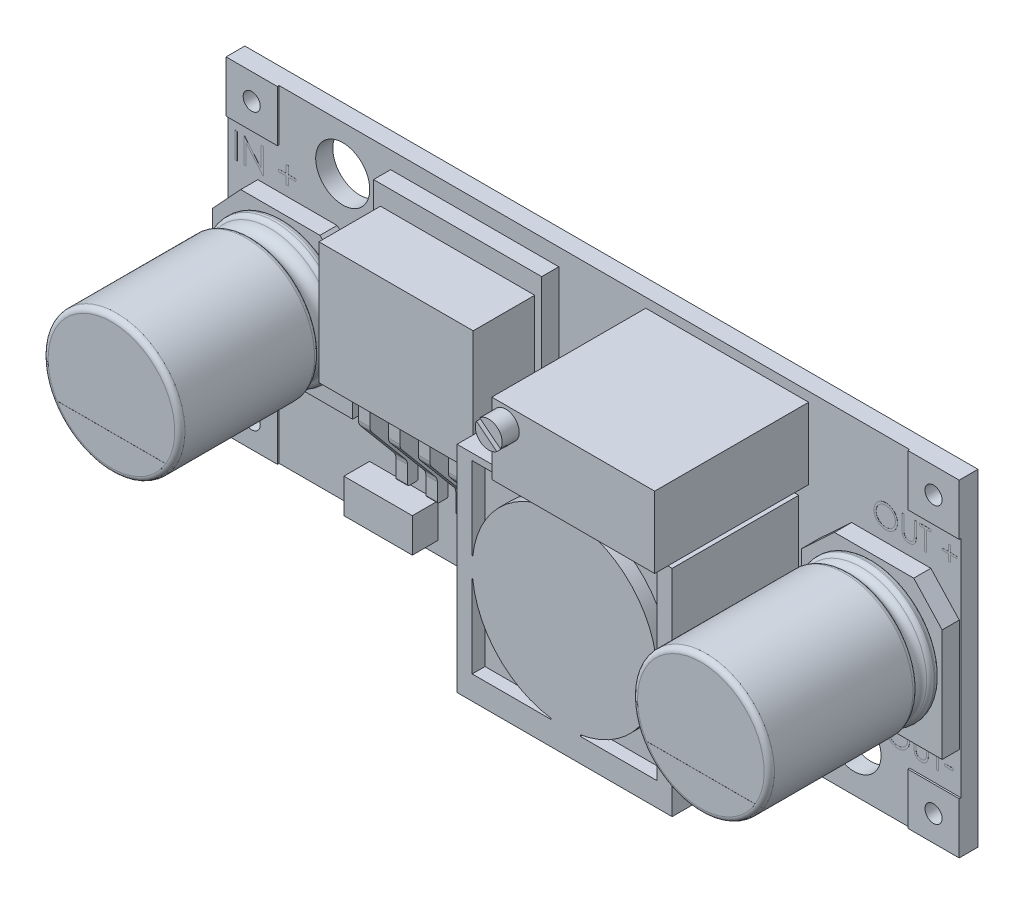
from build123d import *

# Parameters (mm, degrees)
SKETCH1_W            = 42.852737666
SKETCH1_H            = 19.127379028
SKETCH1_R            = 1.58
BOSS_EXTRUDE1_DEPTH  = 1
SKETCH2_W            = 3
SKETCH2_H            = 3
BOSS_EXTRUDE2_DEPTH  = 0.1
SKETCH3_R            = 0.5
CUT_EXTRUDE1_DEPTH   = 5
BOSS_EXTRUDE3_DEPTH  = 1
SKETCH6_W            = 9.83
SKETCH6_H            = 8.75
BOSS_EXTRUDE5_DEPTH  = 4.6
SKETCH7_W            = 9.83
SKETCH7_H            = 8.75
SKETCH7_W_2          = 9.014866003
SKETCH7_H_2          = 7.13033049
CUT_EXTRUDE2_DEPTH   = 3.6
SKETCH8_W            = 0.671327252
SKETCH8_H            = 3.75
BOSS_EXTRUDE6_DEPTH  = 8
SKETCH10_W           = 12.57
SKETCH10_H           = 12.57
BOSS_EXTRUDE7_DEPTH  = 7.4
CUT_EXTRUDE7_DEPTH   = 0.75
SKETCH13_W           = 9.52
SKETCH13_H           = 4.17
BOSS_EXTRUDE8_DEPTH  = 9
SKETCH14_R           = 0.785768403
BOSS_EXTRUDE9_DEPTH  = 1
CUT_EXTRUDE8_DEPTH   = 0.4
CUT_EXTRUDE10_DEPTH  = 9
SKETCH21_W           = 1
SKETCH21_H           = 0.471986251
BOSS_EXTRUDE11_DEPTH = 8.8665
BOSS_EXTRUDE15_DEPTH = 0.005
BOSS_EXTRUDE16_DEPTH = 0.005
SKETCH26_W           = 4
SKETCH26_H           = 2
BOSS_EXTRUDE18_DEPTH = 1.5
SKETCH28_W           = 0.134615385
SKETCH28_H           = 1.5
SKETCH28_W_2         = 0.576923077
SKETCH28_H_2         = 0.153846154
BOSS_EXTRUDE19_DEPTH = 0.005
SKETCH29_W           = 0.134615385
SKETCH29_H           = 1.5
BOSS_EXTRUDE20_DEPTH = 0.005
BOSS_EXTRUDE21_DEPTH = 0.005
SKETCH32_W           = 0.5
SKETCH32_H           = 0.133333333
BOSS_EXTRUDE23_DEPTH = 0.005


with BuildPart() as part:
    # Sketch1 → Boss-Extrude1 (new body)
    with BuildSketch(Plane.XY):
        Rectangle(SKETCH1_W, SKETCH1_H)
        with Locations((-14.706368833, 6.953689514)):
            Circle(SKETCH1_R, mode=Mode.SUBTRACT)
        with Locations((15.176368833, -6.773993326)):
            Circle(SKETCH1_R, mode=Mode.SUBTRACT)
    extrude(amount=BOSS_EXTRUDE1_DEPTH)

    # Sketch2 → Boss-Extrude2 (add)
    with BuildSketch(Plane.XY.offset(1)):
        with Locations((-19.926368833, 8.063689514)):
            Rectangle(SKETCH2_W, SKETCH2_H)
        with Locations((-19.926368833, -8.063689514)):
            Rectangle(SKETCH2_W, SKETCH2_H)
        with Locations((19.926368833, -8.063689514)):
            Rectangle(SKETCH2_W, SKETCH2_H)
        with Locations((19.926368833, 8.063689514)):
            Rectangle(SKETCH2_W, SKETCH2_H)
    extrude(amount=BOSS_EXTRUDE2_DEPTH)

    # Sketch3 → Cut-Extrude1 (cut)
    with BuildSketch(Plane.XY.offset(1.1)):
        with Locations((-19.926368833, 8.063689514)):
            Circle(SKETCH3_R)
        with Locations((-19.926368833, -8.063689514)):
            Circle(SKETCH3_R)
        with Locations((19.926368833, -8.063689514)):
            Circle(SKETCH3_R)
        with Locations((19.926368833, 8.063689514)):
            Circle(SKETCH3_R)
    extrude(amount=-CUT_EXTRUDE1_DEPTH, mode=Mode.SUBTRACT)

    # Sketch4 → Boss-Extrude3 (add)
    with BuildSketch(Plane.XY.offset(1)):
        Polygon((-19.66991348, 4.175), (-21.331368833, 2.383236744), (-21.331368833, -4.175), (-13.121368833, -4.175), (-13.121368833, 2.397984661), (-15.037755442, 4.175), align=None)
        Polygon((19.66991348, 4.175), (15.037755442, 4.175), (13.121368833, 2.397984661), (13.121368833, -4.175), (21.331368833, -4.175), (21.331368833, 2.383236744), align=None)
    extrude(amount=BOSS_EXTRUDE3_DEPTH)

    # Sketch6 → Boss-Extrude5 (add)
    with BuildSketch(Plane.XY.offset(1)):
        with Locations((-6.991368833, 4.188689514)):
            Rectangle(SKETCH6_W, SKETCH6_H)
    extrude(amount=BOSS_EXTRUDE5_DEPTH)

    # Sketch7 → Cut-Extrude2 (cut)
    with BuildSketch(Plane.XY.offset(5.6)):
        with Locations((-6.991368833, 4.188689514)):
            Rectangle(SKETCH7_W, SKETCH7_H)
        with Locations((-6.991368834, 3.853025888)):
            Rectangle(SKETCH7_W_2, SKETCH7_H_2, mode=Mode.SUBTRACT)
    extrude(amount=-CUT_EXTRUDE2_DEPTH, mode=Mode.SUBTRACT)

    # Sketch8 → Boss-Extrude6 (add)
    with BuildSketch(Plane(origin=(0, 0.287860643, 0), x_dir=(-1, 0, 0), z_dir=(0, -1, 0))):
        with Locations((8.85699558, -2.895840935)):
            Rectangle(SKETCH8_W, SKETCH8_H)
        with Locations((10.60699558, -2.895840935)):
            Rectangle(SKETCH8_W, SKETCH8_H)
        with Locations((7.10699558, -2.895840935)):
            Rectangle(SKETCH8_W, SKETCH8_H)
        with Locations((5.35699558, -2.895840935)):
            Rectangle(SKETCH8_W, SKETCH8_H)
        with Locations((3.60699558, -2.895840935)):
            Rectangle(SKETCH8_W, SKETCH8_H)
    extrude(amount=BOSS_EXTRUDE6_DEPTH)

    # Sketch10 → Boss-Extrude7 (add)
    with BuildSketch(Plane.XY.offset(1)):
        with Locations((5.661368833, -2.278689514)):
            Rectangle(SKETCH10_W, SKETCH10_H)
    extrude(amount=BOSS_EXTRUDE7_DEPTH)

    # Sketch11 → Cut-Extrude7 (cut)
    with BuildSketch(Plane.XY.offset(8.4)):
        with BuildLine():
            Line((0.261368833, -1.168201078), (0.29215187, -1.202921155))
            ThreePointArc((0.29215187, -1.202921155), (1.796004083, 1.992113497), (4.952819072, 3.574623221))
            Line((4.952819072, 3.574623221), (4.952819072, 3.621310486))
            Line((4.952819072, 3.621310486), (0.261368833, 3.621310486))
            Line((0.261368833, 3.621310486), (0.261368833, -1.168201078))
        make_face()
        with BuildLine():
            Line((0.261368833, -2.339421454), (0.29215187, -2.354457873))
            ThreePointArc((0.29215187, -2.354457873), (1.77039453, -5.523061153), (4.879917239, -7.121847139))
            Line((4.879917239, -7.121847139), (4.879917239, -7.178689514))
            Line((4.879917239, -7.178689514), (0.261368833, -7.178689514))
            Line((0.261368833, -7.178689514), (0.261368833, -2.339421454))
        make_face()
        with BuildLine():
            Line((11.061368833, -7.178689514), (11.061368833, -2.769135856))
            Line((11.061368833, -2.769135856), (10.969759931, -2.769135856))
            ThreePointArc((10.969759931, -2.769135856), (9.454565933, -5.622080694), (6.581950193, -7.099641493))
            Line((6.581950193, -7.099641493), (6.581950193, -7.178689514))
            Line((6.581950193, -7.178689514), (11.061368833, -7.178689514))
        make_face()
        with BuildLine():
            Line((6.280607425, 3.621310486), (6.280607425, 3.585687763))
            ThreePointArc((6.280607425, 3.585687763), (9.344711933, 2.170105696), (10.969759931, -0.788243173))
            Line((10.969759931, -0.788243173), (11.061368833, -0.788243173))
            Line((11.061368833, -0.788243173), (11.061368833, 3.621310486))
            Line((11.061368833, 3.621310486), (6.280607425, 3.621310486))
        make_face()
    extrude(amount=-CUT_EXTRUDE7_DEPTH, mode=Mode.SUBTRACT)

    # Sketch13 → Boss-Extrude8 (add)
    with BuildSketch(Plane.XY.offset(1)):
        with Locations((7.766965878, 6.922076652)):
            Rectangle(SKETCH13_W, SKETCH13_H)
    extrude(amount=BOSS_EXTRUDE8_DEPTH)

    # Sketch14 → Boss-Extrude9 (add)
    with BuildSketch(Plane.XY.offset(10)):
        with Locations((3.826540336, 8.02238566)):
            Circle(SKETCH14_R)
    extrude(amount=BOSS_EXTRUDE9_DEPTH)

    # Sketch16 → Cut-Extrude8 (cut)
    with BuildSketch(Plane.XY.offset(11)):
        Polygon((3.174779735, 8.708212326), (4.655828555, 7.530657116), (4.452314558, 7.274691057), (2.971265737, 8.452246267), align=None)
    extrude(amount=-CUT_EXTRUDE8_DEPTH, mode=Mode.SUBTRACT)

    # Sketch17 → Revolve1 (revolve)
    with BuildSketch(Plane(origin=(0, 0, 0), x_dir=(1, 0, 0), z_dir=(0, 1, 0))):
        with BuildLine():
            Line((-17.226368833, -2), (-17.226368833, -12))
            Line((-17.226368833, -12), (-20.926368833, -12))
            ThreePointArc((-20.926368833, -12), (-21.138500868, -11.912132034), (-21.226368833, -11.7))
            Line((-21.226368833, -11.7), (-21.226368833, -4.126856579))
            ThreePointArc((-21.226368833, -4.126856579), (-21.171634617, -3.954100406), (-21.027404197, -3.844382058))
            ThreePointArc((-21.027404197, -3.844382058), (-20.635591614, -3.288117016), (-21.027404197, -2.731851974))
            ThreePointArc((-21.027404197, -2.731851974), (-21.171634617, -2.622133626), (-21.226368833, -2.449377452))
            Line((-21.226368833, -2.449377452), (-21.226368833, -2.3))
            ThreePointArc((-21.226368833, -2.3), (-21.138500868, -2.087867966), (-20.926368833, -2))
            Line((-20.926368833, -2), (-17.226368833, -2))
        make_face()
    revolve(axis=Axis((-17.226368833, 0, 2), (0, 0, 1)))

    # Sketch18 → Revolve2 (revolve)
    with BuildSketch(Plane(origin=(0, 0, 0), x_dir=(1, 0, 0), z_dir=(0, 1, 0))):
        with BuildLine():
            Line((17.226368833, -2), (17.226368833, -12))
            Line((17.226368833, -12), (20.926368833, -12))
            ThreePointArc((20.926368833, -12), (21.138500868, -11.912132034), (21.226368833, -11.7))
            Line((21.226368833, -11.7), (21.226368833, -3.602613577))
            ThreePointArc((21.226368833, -3.602613577), (21.180569431, -3.443296107), (21.057155126, -3.332622937))
            ThreePointArc((21.057155126, -3.332622937), (20.838223322, -2.983304086), (21.057155126, -2.633985236))
            ThreePointArc((21.057155126, -2.633985236), (21.180569431, -2.523312065), (21.226368833, -2.363994596))
            Line((21.226368833, -2.363994596), (21.226368833, -2.3))
            ThreePointArc((21.226368833, -2.3), (21.138500868, -2.087867966), (20.926368833, -2))
            Line((20.926368833, -2), (17.226368833, -2))
        make_face()
    revolve(axis=Axis((17.226368833, 0, 2), (0, 0, 1)))

    # Sketch20 → Cut-Extrude10 (cut)
    with BuildSketch(Plane.ZY.offset(10.942659206)):
        with BuildLine():
            Line((3.844382058, 0.289594832), (3.844382058, -2.233611219))
            ThreePointArc((3.844382058, -2.233611219), (3.814255779, -2.404545961), (3.727507314, -2.554882192))
            Line((3.727507314, -2.554882192), (1.771316926, -4.887697811))
            ThreePointArc((1.771316926, -4.887697811), (1.684568461, -5.038034042), (1.654442182, -5.208968784))
            Line((1.654442182, -5.208968784), (1.654442182, -6.229630862))
            ThreePointArc((1.654442182, -6.229630862), (1.62515286, -6.30034154), (1.554442182, -6.329630862))
            Line((1.554442182, -6.329630862), (1.11972155, -6.329630862))
            ThreePointArc((1.11972155, -6.329630862), (1.049409976, -6.300738404), (1.019727886, -6.230756512))
            Line((1.019727886, -6.230756512), (1.020840935, -4.455804963))
            Line((1.020840935, -4.455804963), (1.118926503, -4.336466333))
            Line((1.118926503, -4.336466333), (2.914592321, -2.19508107))
            ThreePointArc((2.914592321, -2.19508107), (3.001340787, -2.044744838), (3.031467065, -1.873810097))
            Line((3.031467065, -1.873810097), (3.031467065, 0.289594832))
            Line((3.031467065, 0.289594832), (1, 0.289594832))
            Line((1, 0.289594832), (1.020840935, -10.491278281))
            Line((1.020840935, -10.491278281), (8.137669671, -10.491278281))
            Line((8.137669671, -10.491278281), (8.137669671, 0.289594832))
            Line((8.137669671, 0.289594832), (3.844382058, 0.289594832))
        make_face()
    extrude(amount=-CUT_EXTRUDE10_DEPTH, mode=Mode.SUBTRACT)

    # Sketch21 → Boss-Extrude11 (add)
    with BuildSketch(Plane(origin=(-10.942659206, 0, 0), x_dir=(0, 0, -1), z_dir=(1, 0, 0))):
        with Locations((-1.5, 0.051867518)):
            Rectangle(SKETCH21_W, SKETCH21_H)
    extrude(amount=BOSS_EXTRUDE11_DEPTH)

    # Sketch24 → Boss-Extrude15 (add)
    # profile 1 of 6: a face of its own
    with BuildSketch(Plane(origin=(0, 0, 0), x_dir=(-1, 0, 0), z_dir=(0, 0, -1))):
        with BuildLine():
            Line((-8.853067867, -3.201602436), (-8.300583893, -3.201602436))
            add(Edge.make_bspline(
                [(-8.300583893, -3.201602436), (-8.237941582, -3.202119806), (-8.116803517, -3.2031203), (-7.941132069, -3.211369625), (-7.778093699, -3.225929961), (-7.627390082, -3.246082478), (-7.489008967, -3.271793508), (-7.362897501, -3.302926325), (-7.248929994, -3.33975745), (-7.146788875, -3.384011044), (-7.052741114, -3.433669947), (-6.964605447, -3.490333151), (-6.880863878, -3.553292994), (-6.800951691, -3.622151102), (-6.726488735, -3.698419974), (-6.656427117, -3.781295695), (-6.590498662, -3.870598609), (-6.528925787, -3.965401624), (-6.473540425, -4.065638061), (-6.425157038, -4.17040503), (-6.383616919, -4.278708953), (-6.350761029, -4.391144359), (-6.324787465, -4.507073724), (-6.30590624, -4.626948975), (-6.294380489, -4.750619862), (-6.293179073, -4.834256468), (-6.292571072, -4.876582403)],
                knots=[0, 0, 0, 0, 1.508928034, 2.917973822, 4.235011166, 5.450779055, 6.579221784, 7.623755204, 8.577985451, 9.460610614, 10.301756591, 11.137250569, 11.981705789, 12.823774396, 13.675702816, 14.546470419, 15.435981066, 16.347923198, 17.267651715, 18.192054867, 19.125737078, 20.059147693, 21.011116727, 21.985721956, 22.980635317, 24, 24, 24, 24], degree=3))
            add(Edge.make_bspline(
                [(-6.292571072, -4.876582403), (-6.293425352, -4.920311883), (-6.295123351, -5.007230329), (-6.307307235, -5.136032527), (-6.327011019, -5.262226316), (-6.354170607, -5.385767842), (-6.3899407, -5.506706382), (-6.434603556, -5.624404735), (-6.485458331, -5.740040139), (-6.545219263, -5.851234457), (-6.609667677, -5.957998129), (-6.679444673, -6.057826354), (-6.752629295, -6.150611392), (-6.831061771, -6.235080332), (-6.913235525, -6.312436895), (-6.99918107, -6.382679297), (-7.089825573, -6.444833173), (-7.185067073, -6.50000274), (-7.287441231, -6.548363362), (-7.398515284, -6.589331765), (-7.518630599, -6.624543208), (-7.64836209, -6.652031833), (-7.787090893, -6.674472281), (-7.935212637, -6.690545123), (-8.092710466, -6.699344016), (-8.200780305, -6.700834932), (-8.25641322, -6.701602436)],
                knots=[0, 0, 0, 0, 1.035326767, 2.057856534, 3.060426681, 4.057975219, 5.050723532, 6.043595218, 7.036960241, 8.039530388, 9.030318104, 9.988216712, 10.921569661, 11.826132526, 12.714780289, 13.59198308, 14.451536877, 15.31430869, 16.195534129, 17.128821459, 18.114698389, 19.15667332, 20.266554844, 21.441073174, 22.682698532, 24, 24, 24, 24], degree=3))
            Line((-8.25641322, -6.701602436), (-9.343853124, -6.701602436))
            Line((-9.343853124, -6.701602436), (-8.853067867, -3.201602436))
        make_face()
        with BuildLine():
            Line((-8.301285015, -3.784935769), (-8.628007771, -6.118269102))
            Line((-8.628007771, -6.118269102), (-8.401545431, -6.118269102))
            add(Edge.make_bspline(
                [(-8.401545431, -6.118269102), (-8.359472268, -6.118053614), (-8.278575358, -6.11763928), (-8.161717216, -6.113000816), (-8.053842471, -6.107478867), (-7.955006915, -6.097225324), (-7.864849413, -6.085815911), (-7.783982406, -6.070951496), (-7.711475788, -6.05497426), (-7.667362252, -6.039888218), (-7.646437258, -6.032732243)],
                knots=[0, 0, 0, 0, 1.323091274, 2.54399687, 3.677836413, 4.719289959, 5.668358043, 6.534823038, 7.305002022, 8, 8, 8, 8], degree=3))
            add(Edge.make_bspline(
                [(-7.646437258, -6.032732243), (-7.619551047, -6.022282483), (-7.566139112, -6.001523071), (-7.490813536, -5.961141901), (-7.417728748, -5.91834265), (-7.350080591, -5.868000695), (-7.285471108, -5.813353309), (-7.226484995, -5.752065729), (-7.170258599, -5.686392133), (-7.118784674, -5.615067595), (-7.071727449, -5.539236121), (-7.03165369, -5.4583046), (-6.997050982, -5.373348417), (-6.969343034, -5.283665493), (-6.947389037, -5.18996392), (-6.932390442, -5.091965491), (-6.921919041, -4.989689841), (-6.921161696, -4.919845967), (-6.920776201, -4.884294743)],
                knots=[0, 0, 0, 0, 0.952655881, 1.892538673, 2.821337892, 3.750040712, 4.676008024, 5.615700279, 6.558436491, 7.532008524, 8.520486916, 9.505184105, 10.513747313, 11.549809891, 12.604882282, 13.692134403, 14.825273528, 16, 16, 16, 16], degree=3))
            add(Edge.make_bspline(
                [(-6.920776201, -4.884294743), (-6.921179041, -4.855071947), (-6.921966371, -4.79795763), (-6.928152939, -4.714096916), (-6.939619582, -4.633858217), (-6.954627208, -4.557196683), (-6.974573544, -4.484179286), (-6.998342056, -4.414821288), (-7.026031761, -4.348620501), (-7.070347076, -4.266962682), (-7.13351499, -4.171693487), (-7.225790052, -4.070996953), (-7.33302123, -3.98497526), (-7.432971683, -3.92486041), (-7.520199452, -3.883726716), (-7.59183677, -3.8573879), (-7.668642489, -3.83477797), (-7.750749545, -3.817072039), (-7.837674138, -3.801859673), (-7.930010535, -3.792738629), (-8.027513589, -3.785982745), (-8.094440862, -3.785290994), (-8.128809053, -3.784935769)],
                knots=[0, 0, 0, 0, 0.941373656, 1.839862062, 2.706559874, 3.551131217, 4.354742518, 5.142827075, 5.911946928, 6.663057697, 8.133107042, 9.582556681, 11.0440985, 12.547036792, 13.328439944, 14.147940985, 15.003216405, 15.905576335, 16.852443473, 17.844335315, 18.893032825, 20, 20, 20, 20], degree=3))
            Line((-8.128809053, -3.784935769), (-8.301285015, -3.784935769))
        make_face(mode=Mode.SUBTRACT)
    # profile 2 of 6: a face of its own
    with BuildSketch(Plane(origin=(0, 0, 0), x_dir=(-1, 0, 0), z_dir=(0, 0, -1))):
        with BuildLine():
            Line((-2.516329085, -3.641906923), (-3.000804245, -4.075901314))
            add(Edge.make_bspline(
                [(-3.000804245, -4.075901314), (-3.027689891, -4.046443608), (-3.081355477, -3.987644013), (-3.174342582, -3.912136081), (-3.27509105, -3.846413961), (-3.384058099, -3.79185051), (-3.499594178, -3.74827086), (-3.620707569, -3.71756322), (-3.746679282, -3.698815861), (-3.832269402, -3.696413914), (-3.875804245, -3.695192179)],
                knots=[0, 0, 0, 0, 0.971056601, 1.938295404, 2.910103745, 3.898650509, 4.902833105, 5.914277838, 6.939111328, 8, 8, 8, 8], degree=3))
            add(Edge.make_bspline(
                [(-3.875804245, -3.695192179), (-3.906675858, -3.695675914), (-3.968088952, -3.696638212), (-4.059697798, -3.706102921), (-4.150266957, -3.72165531), (-4.239943908, -3.742704476), (-4.328944794, -3.76918723), (-4.416297099, -3.803150435), (-4.502814844, -3.842651021), (-4.588093545, -3.887070685), (-4.670046059, -3.937343286), (-4.748053762, -3.991342039), (-4.821369329, -4.048887662), (-4.889619278, -4.110909594), (-4.953232815, -4.176978556), (-5.013363848, -4.246067771), (-5.067011582, -4.32032101), (-5.116983668, -4.396986923), (-5.160899411, -4.47683975), (-5.199278835, -4.558168777), (-5.233164672, -4.640393752), (-5.258161359, -4.724798488), (-5.280114045, -4.809950053), (-5.294189305, -4.89679304), (-5.304020845, -4.984796415), (-5.304933001, -5.043888985), (-5.305391585, -5.073597628)],
                knots=[0, 0, 0, 0, 1.01063672, 2.010466049, 3.011934156, 4.018040672, 5.025194429, 6.049901815, 7.084166442, 8.138480354, 9.196343408, 10.230183256, 11.243713301, 12.245999792, 13.247233952, 14.245803109, 15.242258641, 16.244194478, 17.240973215, 18.223430354, 19.188354289, 20.149355445, 21.103383867, 22.065846529, 23.027609163, 24, 24, 24, 24], degree=3))
            add(Edge.make_bspline(
                [(-5.305391585, -5.073597628), (-5.304618516, -5.113391242), (-5.303097502, -5.191685253), (-5.286027884, -5.306388491), (-5.2606216, -5.416222202), (-5.223849505, -5.520820556), (-5.176425789, -5.619953738), (-5.119765611, -5.714793755), (-5.050821374, -5.803061224), (-4.973598797, -5.886385022), (-4.887657649, -5.961519344), (-4.795556562, -6.028219859), (-4.696709043, -6.083473122), (-4.592429621, -6.1296467), (-4.481782992, -6.164421161), (-4.365622271, -6.189522151), (-4.243638542, -6.205554834), (-4.160277037, -6.207181632), (-4.117691265, -6.208012692)],
                knots=[0, 0, 0, 0, 1.037508871, 2.041300697, 3.018951676, 3.975513831, 4.927438979, 5.88223082, 6.851861871, 7.844178858, 8.842305637, 9.825493826, 10.805727671, 11.791408773, 12.796144752, 13.825955475, 14.88937509, 16, 16, 16, 16], degree=3))
            add(Edge.make_bspline(
                [(-4.117691265, -6.208012692), (-4.071855206, -6.207230549), (-3.981640883, -6.205691138), (-3.848815917, -6.192765403), (-3.720676217, -6.1717802), (-3.597313824, -6.14259959), (-3.478605564, -6.104256454), (-3.364521871, -6.058307341), (-3.254927312, -6.003502583), (-3.186042547, -5.96037832), (-3.151545431, -5.938781923)],
                knots=[0, 0, 0, 0, 1.080949117, 2.127519159, 3.144326023, 4.141762213, 5.114520833, 6.083915527, 7.040435296, 8, 8, 8, 8], degree=3))
            Line((-3.151545431, -5.938781923), (-2.758216104, -6.372075192))
            add(Edge.make_bspline(
                [(-2.758216104, -6.372075192), (-2.808420285, -6.405619613), (-2.908553491, -6.472524609), (-3.067420241, -6.557854709), (-3.232244225, -6.629482919), (-3.402422898, -6.688487904), (-3.578358143, -6.735128768), (-3.760308538, -6.767720941), (-3.948257224, -6.788017038), (-4.075571862, -6.790225976), (-4.140127162, -6.791346025)],
                knots=[0, 0, 0, 0, 0.987115275, 1.968820479, 2.944554184, 3.923725951, 4.912076401, 5.918257257, 6.944445583, 8, 8, 8, 8], degree=3))
            add(Edge.make_bspline(
                [(-4.140127162, -6.791346025), (-4.185251648, -6.79064853), (-4.273972366, -6.789277163), (-4.404318153, -6.779211808), (-4.529637736, -6.763462206), (-4.649689886, -6.740131924), (-4.764708942, -6.710859161), (-4.874722042, -6.675176034), (-4.979294215, -6.632155799), (-5.079055533, -6.583302387), (-5.173473742, -6.527349338), (-5.263416272, -6.465790051), (-5.348210229, -6.397518319), (-5.428568985, -6.323744653), (-5.503749999, -6.243559869), (-5.573944978, -6.156875672), (-5.639773669, -6.064401239), (-5.70059437, -5.966617988), (-5.755204621, -5.864510256), (-5.802525631, -5.759422355), (-5.843974618, -5.652784518), (-5.875684831, -5.543225299), (-5.90207982, -5.432193883), (-5.919990953, -5.318507609), (-5.931786958, -5.20308897), (-5.932991892, -5.125276243), (-5.933596713, -5.08621782)],
                knots=[0, 0, 0, 0, 1.169367826, 2.299132101, 3.38621766, 4.441052208, 5.466435492, 6.460518735, 7.435693363, 8.394593391, 9.33676259, 10.277587488, 11.216890426, 12.155626877, 13.10261201, 14.062754619, 15.044266364, 16.042621295, 17.045211417, 18.042739217, 19.028130471, 20.007415779, 20.996189116, 21.983978755, 22.988049715, 24, 24, 24, 24], degree=3))
            add(Edge.make_bspline(
                [(-5.933596713, -5.08621782), (-5.932861533, -5.04411236), (-5.931395617, -4.960155988), (-5.917258447, -4.834871806), (-5.895871713, -4.710906453), (-5.865255859, -4.588265385), (-5.827115892, -4.466902485), (-5.778657886, -4.347333602), (-5.722841666, -4.228544831), (-5.657519442, -4.112320265), (-5.58623039, -3.999158565), (-5.507106607, -3.892166544), (-5.422083349, -3.791259164), (-5.331916975, -3.695486851), (-5.234644888, -3.606974946), (-5.131164403, -3.524800413), (-5.021858395, -3.448393062), (-4.906896824, -3.37836971), (-4.787888864, -3.315426453), (-4.665133983, -3.261466361), (-4.540055011, -3.214775861), (-4.412146752, -3.177011734), (-4.281335611, -3.148296897), (-4.148154069, -3.127222676), (-4.012079129, -3.114262257), (-3.920470313, -3.112663054), (-3.874402002, -3.111858846)],
                knots=[0, 0, 0, 0, 0.95794203, 1.910092795, 2.865876462, 3.819215003, 4.78477586, 5.758651491, 6.753180615, 7.769892659, 8.790977917, 9.795230985, 10.79565955, 11.792688852, 12.786634645, 13.785945562, 14.798181656, 15.819862441, 16.847685968, 17.859754353, 18.869513914, 19.884373831, 20.892254455, 21.915374149, 22.951681752, 24, 24, 24, 24], degree=3))
            add(Edge.make_bspline(
                [(-3.874402002, -3.111858846), (-3.810055091, -3.11349608), (-3.682990372, -3.116729098), (-3.495855983, -3.141778928), (-3.315253236, -3.183068658), (-3.141427217, -3.241768031), (-2.973739072, -3.316085821), (-2.813300361, -3.407960246), (-2.659434296, -3.516158186), (-2.564439018, -3.599631989), (-2.516329085, -3.641906923)],
                knots=[0, 0, 0, 0, 1.033545388, 2.040923972, 3.027343848, 4.005734438, 4.983995331, 5.969464303, 6.971644303, 8, 8, 8, 8], degree=3))
        make_face()
    # profile 3 of 6: a face of its own
    with BuildSketch(Plane(origin=(0, 0, 0), x_dir=(-1, 0, 0), z_dir=(0, 0, -1))):
        Polygon((-0.410159213, -3.111858846), (0.222953767, -3.111858846), (0.079924921, -4.143910128), (0.480265466, -4.143910128), (0.404544312, -4.682371666), (0.004904889, -4.682371666), (-0.274842707, -6.701602436), (-0.907955688, -6.701602436), (-0.628208092, -4.682371666), (-0.938103925, -4.682371666), (-0.865187258, -4.143910128), (-0.55318806, -4.143910128), align=None)
    # profile 4 of 6: a face of its own
    with BuildSketch(Plane(origin=(0, 0, 0), x_dir=(-1, 0, 0), z_dir=(0, 0, -1))):
        with BuildLine():
            add(Edge.make_bspline(
                [(2.047973799, -4.099038333), (2.076274595, -4.099299194), (2.132285658, -4.099815473), (2.215320607, -4.108289871), (2.296630321, -4.119781478), (2.375824228, -4.136585397), (2.452832337, -4.158540762), (2.527980657, -4.185285631), (2.60145491, -4.216550706), (2.672238505, -4.253235701), (2.740269169, -4.293778731), (2.804923453, -4.338492614), (2.865124606, -4.38802221), (2.922560732, -4.440435569), (2.974812186, -4.498109595), (3.023299378, -4.559402443), (3.068608414, -4.624279456), (3.109671999, -4.693140326), (3.145833773, -4.765563415), (3.178489854, -4.839690233), (3.205172311, -4.916663144), (3.226421779, -4.995747754), (3.2447274, -5.076764828), (3.255780853, -5.160081933), (3.264388007, -5.245427615), (3.264874499, -5.303074566), (3.265121235, -5.33231157)],
                knots=[0, 0, 0, 0, 1.048380346, 2.074885017, 3.090367486, 4.090964834, 5.072523792, 6.056029873, 7.045505985, 8.029469653, 9.008388104, 9.979110116, 10.939576094, 11.895736256, 12.858269977, 13.820062943, 14.790784955, 15.789017664, 16.788414625, 17.789274365, 18.789121639, 19.804049856, 20.823403653, 21.864603227, 22.916983403, 24, 24, 24, 24], degree=3))
            add(Edge.make_bspline(
                [(3.265121235, -5.33231157), (3.263688521, -5.380517747), (3.260866665, -5.475463977), (3.241081251, -5.615137253), (3.207266567, -5.74903449), (3.159927545, -5.877543045), (3.099373535, -6.000696485), (3.02535317, -6.118605175), (2.937002499, -6.230040516), (2.837387566, -6.33526087), (2.728079792, -6.431651196), (2.610873296, -6.515964174), (2.4872728, -6.58723861), (2.357586463, -6.646044139), (2.220868971, -6.690744346), (2.07813408, -6.722759932), (1.929142107, -6.743245327), (1.827655912, -6.74538424), (1.775938543, -6.74647423)],
                knots=[0, 0, 0, 0, 1.011104245, 1.991457176, 2.952197104, 3.902991464, 4.858928698, 5.826026836, 6.817568841, 7.837123857, 8.861887107, 9.870051414, 10.860623363, 11.850212162, 12.851715058, 13.872153699, 14.915649431, 16, 16, 16, 16], degree=3))
            add(Edge.make_bspline(
                [(1.775938543, -6.74647423), (1.731249527, -6.745651728), (1.643928175, -6.744044575), (1.516603984, -6.728008378), (1.396019942, -6.703330608), (1.282509145, -6.667113928), (1.175619563, -6.621862978), (1.075787771, -6.565800352), (0.982759572, -6.499972186), (0.898424611, -6.423206126), (0.821653652, -6.339253127), (0.755109673, -6.247910845), (0.698196439, -6.150383479), (0.652979584, -6.046129966), (0.616951777, -5.936058116), (0.591083712, -5.819874659), (0.575325308, -5.697330635), (0.573662775, -5.613509398), (0.572813543, -5.57069298)],
                knots=[0, 0, 0, 0, 1.130534475, 2.209039425, 3.242686211, 4.241648197, 5.219495055, 6.175504508, 7.134035888, 8.097337106, 9.056251676, 10.008649417, 10.952170628, 11.908308165, 12.879116703, 13.879338768, 14.916752852, 16, 16, 16, 16], degree=3))
            add(Edge.make_bspline(
                [(0.572813543, -5.57069298), (0.574198313, -5.518982083), (0.576922459, -5.417255379), (0.597291897, -5.267943873), (0.632580393, -5.125671277), (0.6813243, -4.990183027), (0.742880461, -4.860841068), (0.820364868, -4.739285803), (0.910265871, -4.623536234), (1.013729882, -4.516782318), (1.125759831, -4.419397073), (1.243349941, -4.333250807), (1.366627978, -4.261598623), (1.493529484, -4.201082976), (1.626190512, -4.155869136), (1.762694186, -4.122668379), (1.903868267, -4.102397962), (1.999529842, -4.100167739), (2.047973799, -4.099038333)],
                knots=[0, 0, 0, 0, 1.070407058, 2.105725986, 3.11260329, 4.099768105, 5.082273654, 6.071629737, 7.078227986, 8.111679688, 9.144009435, 10.148605521, 11.124500349, 12.092034995, 13.054511379, 14.020338642, 14.997480131, 16, 16, 16, 16], degree=3))
        make_face()
        with BuildLine():
            add(Edge.make_bspline(
                [(2.001699761, -4.682371666), (1.970338874, -4.683134377), (1.909219823, -4.68462082), (1.820371221, -4.697480802), (1.737116329, -4.718430504), (1.65914239, -4.747759684), (1.587488188, -4.786890542), (1.520576481, -4.833288128), (1.460350398, -4.889250385), (1.406081405, -4.952161975), (1.358245618, -5.020002489), (1.316206249, -5.089796935), (1.280624192, -5.161264017), (1.252338528, -5.234222955), (1.228428254, -5.308196637), (1.212541328, -5.383864445), (1.203329833, -5.461089737), (1.201794454, -5.512942704), (1.201018671, -5.5391425)],
                knots=[0, 0, 0, 0, 1.147646984, 2.236642535, 3.278363253, 4.285788599, 5.277283386, 6.259990092, 7.25913394, 8.278119336, 9.296601724, 10.294389209, 11.258634566, 12.215104854, 13.156804447, 14.101569642, 15.040778374, 16, 16, 16, 16], degree=3))
            add(Edge.make_bspline(
                [(1.201018671, -5.5391425), (1.201601551, -5.562064552), (1.202740963, -5.606872574), (1.210344539, -5.672404719), (1.22384553, -5.734276966), (1.241836873, -5.792939391), (1.266036711, -5.848077326), (1.295236911, -5.899903115), (1.330284842, -5.947905553), (1.36903979, -5.992964645), (1.413485986, -6.03267378), (1.461057482, -6.067795173), (1.512112733, -6.097851128), (1.567183892, -6.121362981), (1.625520167, -6.140560096), (1.687347255, -6.15367305), (1.752600705, -6.161479998), (1.797183596, -6.162576862), (1.820109216, -6.163140897)],
                knots=[0, 0, 0, 0, 1.110133544, 2.170088686, 3.189065258, 4.17351184, 5.136579884, 6.099647928, 7.048308506, 8.010844321, 8.972448026, 9.927769731, 10.871216919, 11.834284962, 12.822174017, 13.841150589, 14.889866456, 16, 16, 16, 16], degree=3))
            add(Edge.make_bspline(
                [(1.820109216, -6.163140897), (1.852396439, -6.162309401), (1.915329168, -6.160688687), (2.006752353, -6.148807507), (2.092157747, -6.128631912), (2.171520471, -6.099746544), (2.244757291, -6.062223255), (2.312768778, -6.017389235), (2.37401388, -5.963374241), (2.429161959, -5.902432595), (2.477619401, -5.836248997), (2.519922528, -5.766868854), (2.556594156, -5.695618423), (2.586181307, -5.62167797), (2.608565063, -5.545547851), (2.624745195, -5.467237991), (2.634787654, -5.386557462), (2.636202075, -5.331872791), (2.636916107, -5.304266698)],
                knots=[0, 0, 0, 0, 1.164111062, 2.269030304, 3.317651816, 4.322802953, 5.30652745, 6.278887004, 7.252451034, 8.242831511, 9.237327035, 10.205734188, 11.170614506, 12.123681709, 13.072978069, 14.028315502, 15.004647829, 16, 16, 16, 16], degree=3))
            add(Edge.make_bspline(
                [(2.636916107, -5.304266698), (2.636389507, -5.281805954), (2.635354416, -5.237656817), (2.626861779, -5.173063933), (2.612670679, -5.111911081), (2.594004984, -5.053572817), (2.568363816, -4.999146348), (2.538407469, -4.947143567), (2.501272598, -4.899639821), (2.460229432, -4.854843601), (2.414885669, -4.814121082), (2.365286189, -4.779019773), (2.312962754, -4.74858569), (2.256729337, -4.72478642), (2.197581756, -4.705876334), (2.135261979, -4.69159541), (2.069423748, -4.684129775), (2.024619754, -4.682966667), (2.001699761, -4.682371666)],
                knots=[0, 0, 0, 0, 1.079193067, 2.121276228, 3.123935011, 4.093589047, 5.058482656, 6.010079462, 6.971567708, 7.949254825, 8.927715837, 9.893916005, 10.864935156, 11.830939453, 12.821955205, 13.846519011, 14.898362312, 16, 16, 16, 16], degree=3))
        make_face(mode=Mode.SUBTRACT)
    # profile 5 of 6: a face of its own
    with BuildSketch(Plane(origin=(0, 0, 0), x_dir=(-1, 0, 0), z_dir=(0, 0, -1))):
        with BuildLine():
            Line((5.550778287, -3.201602436), (6.103262261, -3.201602436))
            add(Edge.make_bspline(
                [(6.103262261, -3.201602436), (6.165904571, -3.202119806), (6.287042636, -3.2031203), (6.462714085, -3.211369625), (6.625752455, -3.225929961), (6.776456072, -3.246082478), (6.914837187, -3.271793508), (7.040948653, -3.302926325), (7.15491616, -3.33975745), (7.257057279, -3.384011044), (7.35110504, -3.433669947), (7.439240707, -3.490333151), (7.522982276, -3.553292994), (7.602894463, -3.622151102), (7.677357419, -3.698419974), (7.747419037, -3.781295695), (7.813347492, -3.870598609), (7.874920367, -3.965401624), (7.930305729, -4.065638061), (7.978689115, -4.17040503), (8.020229235, -4.278708953), (8.053085125, -4.391144359), (8.079058689, -4.507073724), (8.097939914, -4.626948975), (8.109465665, -4.750619862), (8.110667081, -4.834256468), (8.111275081, -4.876582403)],
                knots=[0, 0, 0, 0, 1.508928034, 2.917973822, 4.235011166, 5.450779055, 6.579221784, 7.623755204, 8.577985451, 9.460610614, 10.301756591, 11.137250569, 11.981705789, 12.823774396, 13.675702816, 14.546470419, 15.435981066, 16.347923198, 17.267651715, 18.192054867, 19.125737078, 20.059147693, 21.011116727, 21.985721956, 22.980635317, 24, 24, 24, 24], degree=3))
            add(Edge.make_bspline(
                [(8.111275081, -4.876582403), (8.110420802, -4.920311883), (8.108722803, -5.007230329), (8.096538919, -5.136032527), (8.076835135, -5.262226316), (8.049675547, -5.385767842), (8.013905454, -5.506706382), (7.969242598, -5.624404735), (7.918387823, -5.740040139), (7.858626891, -5.851234457), (7.794178477, -5.957998129), (7.724401481, -6.057826354), (7.651216859, -6.150611392), (7.572784383, -6.235080332), (7.490610629, -6.312436895), (7.404665084, -6.382679297), (7.314020581, -6.444833173), (7.21877908, -6.50000274), (7.116404923, -6.548363362), (7.005330869, -6.589331765), (6.885215554, -6.624543208), (6.755484064, -6.652031833), (6.616755261, -6.674472281), (6.468633517, -6.690545123), (6.311135688, -6.699344016), (6.203065849, -6.700834932), (6.147432934, -6.701602436)],
                knots=[0, 0, 0, 0, 1.035326767, 2.057856534, 3.060426681, 4.057975219, 5.050723532, 6.043595218, 7.036960241, 8.039530388, 9.030318104, 9.988216712, 10.921569661, 11.826132526, 12.714780289, 13.59198308, 14.451536877, 15.31430869, 16.195534129, 17.128821459, 18.114698389, 19.15667332, 20.266554844, 21.441073174, 22.682698532, 24, 24, 24, 24], degree=3))
            Line((6.147432934, -6.701602436), (5.05999303, -6.701602436))
            Line((5.05999303, -6.701602436), (5.550778287, -3.201602436))
        make_face()
        with BuildLine():
            Line((6.102561139, -3.784935769), (5.775838383, -6.118269102))
            Line((5.775838383, -6.118269102), (6.002300723, -6.118269102))
            add(Edge.make_bspline(
                [(6.002300723, -6.118269102), (6.044373886, -6.118053614), (6.125270795, -6.11763928), (6.242128938, -6.113000816), (6.350003683, -6.107478867), (6.448839239, -6.097225324), (6.538996741, -6.085815911), (6.619863748, -6.070951496), (6.692370365, -6.05497426), (6.736483902, -6.039888218), (6.757408896, -6.032732243)],
                knots=[0, 0, 0, 0, 1.323091274, 2.54399687, 3.677836413, 4.719289959, 5.668358043, 6.534823038, 7.305002022, 8, 8, 8, 8], degree=3))
            add(Edge.make_bspline(
                [(6.757408896, -6.032732243), (6.784295107, -6.022282483), (6.837707042, -6.001523071), (6.913032618, -5.961141901), (6.986117406, -5.91834265), (7.053765563, -5.868000695), (7.118375045, -5.813353309), (7.177361159, -5.752065729), (7.233587555, -5.686392133), (7.28506148, -5.615067595), (7.332118704, -5.539236121), (7.372192464, -5.4583046), (7.406795172, -5.373348417), (7.434503119, -5.283665493), (7.456457117, -5.18996392), (7.471455712, -5.091965491), (7.481927113, -4.989689841), (7.482684458, -4.919845967), (7.483069953, -4.884294743)],
                knots=[0, 0, 0, 0, 0.952655881, 1.892538673, 2.821337892, 3.750040712, 4.676008024, 5.615700279, 6.558436491, 7.532008524, 8.520486916, 9.505184105, 10.513747313, 11.549809891, 12.604882282, 13.692134403, 14.825273528, 16, 16, 16, 16], degree=3))
            add(Edge.make_bspline(
                [(7.483069953, -4.884294743), (7.482667113, -4.855071947), (7.481879783, -4.79795763), (7.475693215, -4.714096916), (7.464226572, -4.633858217), (7.449218945, -4.557196683), (7.42927261, -4.484179286), (7.405504098, -4.414821288), (7.377814393, -4.348620501), (7.333499078, -4.266962682), (7.270331164, -4.171693487), (7.178056101, -4.070996953), (7.070824924, -3.98497526), (6.97087447, -3.92486041), (6.883646702, -3.883726716), (6.812009384, -3.8573879), (6.735203665, -3.83477797), (6.653096609, -3.817072039), (6.566172016, -3.801859673), (6.473835619, -3.792738629), (6.376332565, -3.785982745), (6.309405291, -3.785290994), (6.275037101, -3.784935769)],
                knots=[0, 0, 0, 0, 0.941373656, 1.839862062, 2.706559874, 3.551131217, 4.354742518, 5.142827075, 5.911946928, 6.663057697, 8.133107042, 9.582556681, 11.0440985, 12.547036792, 13.328439944, 14.147940985, 15.003216405, 15.905576335, 16.852443473, 17.844335315, 18.893032825, 20, 20, 20, 20], degree=3))
            Line((6.275037101, -3.784935769), (6.102561139, -3.784935769))
        make_face(mode=Mode.SUBTRACT)
    # profile 6 of 6: a face of its own
    with BuildSketch(Plane(origin=(0, 0, 0), x_dir=(-1, 0, 0), z_dir=(0, 0, -1))):
        with BuildLine():
            Line((11.887517069, -3.641906923), (11.403041908, -4.075901314))
            add(Edge.make_bspline(
                [(11.403041908, -4.075901314), (11.376156263, -4.046443608), (11.322490677, -3.987644013), (11.229503572, -3.912136081), (11.128755104, -3.846413961), (11.019788055, -3.79185051), (10.904251976, -3.74827086), (10.783138585, -3.71756322), (10.657166872, -3.698815861), (10.571576752, -3.696413914), (10.528041908, -3.695192179)],
                knots=[0, 0, 0, 0, 0.971056601, 1.938295404, 2.910103745, 3.898650509, 4.902833105, 5.914277838, 6.939111328, 8, 8, 8, 8], degree=3))
            add(Edge.make_bspline(
                [(10.528041908, -3.695192179), (10.497170296, -3.695675914), (10.435757202, -3.696638212), (10.344148356, -3.706102921), (10.253579197, -3.72165531), (10.163902246, -3.742704476), (10.07490136, -3.76918723), (9.987549055, -3.803150435), (9.90103131, -3.842651021), (9.815752609, -3.887070685), (9.733800095, -3.937343286), (9.655792392, -3.991342039), (9.582476825, -4.048887662), (9.514226876, -4.110909594), (9.450613339, -4.176978556), (9.390482306, -4.246067771), (9.336834572, -4.32032101), (9.286862486, -4.396986923), (9.242946742, -4.47683975), (9.204567319, -4.558168777), (9.170681482, -4.640393752), (9.145684795, -4.724798488), (9.123732109, -4.809950053), (9.109656849, -4.89679304), (9.099825309, -4.984796415), (9.098913153, -5.043888985), (9.098454569, -5.073597628)],
                knots=[0, 0, 0, 0, 1.01063672, 2.010466049, 3.011934156, 4.018040672, 5.025194429, 6.049901815, 7.084166442, 8.138480354, 9.196343408, 10.230183256, 11.243713301, 12.245999792, 13.247233952, 14.245803109, 15.242258641, 16.244194478, 17.240973215, 18.223430354, 19.188354289, 20.149355445, 21.103383867, 22.065846529, 23.027609163, 24, 24, 24, 24], degree=3))
            add(Edge.make_bspline(
                [(9.098454569, -5.073597628), (9.099227638, -5.113391242), (9.100748652, -5.191685253), (9.117818269, -5.306388491), (9.143224554, -5.416222202), (9.179996649, -5.520820556), (9.227420365, -5.619953738), (9.284080543, -5.714793755), (9.353024779, -5.803061224), (9.430247356, -5.886385022), (9.516188505, -5.961519344), (9.608289592, -6.028219859), (9.707137111, -6.083473122), (9.811416533, -6.1296467), (9.922063162, -6.164421161), (10.038223882, -6.189522151), (10.160207612, -6.205554834), (10.243569117, -6.207181632), (10.286154889, -6.208012692)],
                knots=[0, 0, 0, 0, 1.037508871, 2.041300697, 3.018951676, 3.975513831, 4.927438979, 5.88223082, 6.851861871, 7.844178858, 8.842305637, 9.825493826, 10.805727671, 11.791408773, 12.796144752, 13.825955475, 14.88937509, 16, 16, 16, 16], degree=3))
            add(Edge.make_bspline(
                [(10.286154889, -6.208012692), (10.331990948, -6.207230549), (10.422205271, -6.205691138), (10.555030237, -6.192765403), (10.683169937, -6.1717802), (10.80653233, -6.14259959), (10.92524059, -6.104256454), (11.039324283, -6.058307341), (11.148918842, -6.003502583), (11.217803606, -5.96037832), (11.252300723, -5.938781923)],
                knots=[0, 0, 0, 0, 1.080949117, 2.127519159, 3.144326023, 4.141762213, 5.114520833, 6.083915527, 7.040435296, 8, 8, 8, 8], degree=3))
            Line((11.252300723, -5.938781923), (11.645630049, -6.372075192))
            add(Edge.make_bspline(
                [(11.645630049, -6.372075192), (11.595425869, -6.405619613), (11.495292663, -6.472524609), (11.336425913, -6.557854709), (11.171601929, -6.629482919), (11.001423256, -6.688487904), (10.825488011, -6.735128768), (10.643537616, -6.767720941), (10.455588929, -6.788017038), (10.328274292, -6.790225976), (10.263718992, -6.791346025)],
                knots=[0, 0, 0, 0, 0.987115275, 1.968820479, 2.944554184, 3.923725951, 4.912076401, 5.918257257, 6.944445583, 8, 8, 8, 8], degree=3))
            add(Edge.make_bspline(
                [(10.263718992, -6.791346025), (10.218594506, -6.79064853), (10.129873788, -6.789277163), (9.999528001, -6.779211808), (9.874208418, -6.763462206), (9.754156268, -6.740131924), (9.639137212, -6.710859161), (9.529124111, -6.675176034), (9.424551939, -6.632155799), (9.324790621, -6.583302387), (9.230372412, -6.527349338), (9.140429882, -6.465790051), (9.055635925, -6.397518319), (8.975277169, -6.323744653), (8.900096155, -6.243559869), (8.829901176, -6.156875672), (8.764072484, -6.064401239), (8.703251784, -5.966617988), (8.648641533, -5.864510256), (8.601320523, -5.759422355), (8.559871535, -5.652784518), (8.528161323, -5.543225299), (8.501766333, -5.432193883), (8.483855201, -5.318507609), (8.472059196, -5.20308897), (8.470854262, -5.125276243), (8.47024944, -5.08621782)],
                knots=[0, 0, 0, 0, 1.169367826, 2.299132101, 3.38621766, 4.441052208, 5.466435492, 6.460518735, 7.435693363, 8.394593391, 9.33676259, 10.277587488, 11.216890426, 12.155626877, 13.10261201, 14.062754619, 15.044266364, 16.042621295, 17.045211417, 18.042739217, 19.028130471, 20.007415779, 20.996189116, 21.983978755, 22.988049715, 24, 24, 24, 24], degree=3))
            add(Edge.make_bspline(
                [(8.47024944, -5.08621782), (8.470984621, -5.04411236), (8.472450537, -4.960155988), (8.486587707, -4.834871806), (8.507974441, -4.710906453), (8.538590295, -4.588265385), (8.576730262, -4.466902485), (8.625188268, -4.347333602), (8.681004488, -4.228544831), (8.746326712, -4.112320265), (8.817615763, -3.999158565), (8.896739547, -3.892166544), (8.981762805, -3.791259164), (9.071929179, -3.695486851), (9.169201265, -3.606974946), (9.272681751, -3.524800413), (9.381987759, -3.448393062), (9.49694933, -3.37836971), (9.615957289, -3.315426453), (9.738712171, -3.261466361), (9.863791143, -3.214775861), (9.991699402, -3.177011734), (10.122510542, -3.148296897), (10.255692085, -3.127222676), (10.391767024, -3.114262257), (10.48337584, -3.112663054), (10.529444152, -3.111858846)],
                knots=[0, 0, 0, 0, 0.95794203, 1.910092795, 2.865876462, 3.819215003, 4.78477586, 5.758651491, 6.753180615, 7.769892659, 8.790977917, 9.795230985, 10.79565955, 11.792688852, 12.786634645, 13.785945562, 14.798181656, 15.819862441, 16.847685968, 17.859754353, 18.869513914, 19.884373831, 20.892254455, 21.915374149, 22.951681752, 24, 24, 24, 24], degree=3))
            add(Edge.make_bspline(
                [(10.529444152, -3.111858846), (10.593791063, -3.11349608), (10.720855781, -3.116729098), (10.907990171, -3.141778928), (11.088592918, -3.183068658), (11.262418937, -3.241768031), (11.430107082, -3.316085821), (11.590545793, -3.407960246), (11.744411858, -3.516158186), (11.839407136, -3.599631989), (11.887517069, -3.641906923)],
                knots=[0, 0, 0, 0, 1.033545388, 2.040923972, 3.027343848, 4.005734438, 4.983995331, 5.969464303, 6.971644303, 8, 8, 8, 8], degree=3))
        make_face()
    extrude(amount=BOSS_EXTRUDE15_DEPTH)

    # Sketch25 → Boss-Extrude16 (add)
    with BuildSketch(Plane.XY.offset(12)):
        with BuildLine():
            Line((-20.407271534, -1.889935981), (-14.045466133, -1.889935981))
            ThreePointArc((-14.045466133, -1.889935981), (-17.226368833, -3.7), (-20.407271534, -1.889935981))
        make_face()
        with BuildLine():
            Line((14.045466133, -1.889935981), (20.407271534, -1.889935981))
            ThreePointArc((20.407271534, -1.889935981), (17.226368833, -3.7), (14.045466133, -1.889935981))
        make_face()
    extrude(amount=BOSS_EXTRUDE16_DEPTH)

    # Sketch26 → Boss-Extrude18 (add)
    with BuildSketch(Plane.XY.offset(1)):
        with Locations((-11.138607867, -7.817905836)):
            Rectangle(SKETCH26_W, SKETCH26_H)
    extrude(amount=BOSS_EXTRUDE18_DEPTH)

    # Sketch28 → Boss-Extrude19 (add)
    with BuildSketch(Plane.XY.offset(1)):
        with Locations((-20.935508826, -5.438559187)):
            Rectangle(SKETCH28_W, SKETCH28_H)
        Polygon((-20.483585748, -6.188559187), (-20.483585748, -4.688559187), (-20.455340556, -4.688559187), (-19.464354979, -5.869148129), (-19.464354979, -4.688559187), (-19.329739595, -4.688559187), (-19.329739595, -6.188559187), (-19.360388633, -6.188559187), (-20.348970364, -5.010674571), (-20.348970364, -6.188559187), align=None)
        with Locations((-18.791278056, -5.61163611)):
            Rectangle(SKETCH28_W_2, SKETCH28_H_2)
    extrude(amount=BOSS_EXTRUDE19_DEPTH)

    # Sketch29 → Boss-Extrude20 (add)
    with BuildSketch(Plane.XY.offset(1)):
        with Locations((-20.935508826, 5.271218629)):
            Rectangle(SKETCH29_W, SKETCH29_H)
        Polygon((-20.483585748, 4.521218629), (-20.483585748, 6.021218629), (-20.455340556, 6.021218629), (-19.464354979, 4.840629686), (-19.464354979, 6.021218629), (-19.329739595, 6.021218629), (-19.329739595, 4.521218629), (-19.360388633, 4.521218629), (-20.348970364, 5.699103244), (-20.348970364, 4.521218629), align=None)
        Polygon((-18.002816518, 5.328910936), (-18.002816518, 5.771218629), (-17.868201133, 5.771218629), (-17.868201133, 5.328910936), (-17.425893441, 5.328910936), (-17.425893441, 5.194295552), (-17.868201133, 5.194295552), (-17.868201133, 4.75198786), (-18.002816518, 4.75198786), (-18.002816518, 5.194295552), (-18.44512421, 5.194295552), (-18.44512421, 5.328910936), align=None)
    extrude(amount=BOSS_EXTRUDE20_DEPTH)

    # Sketch30 → Boss-Extrude21 (add)
    # profile 1 of 4: a face of its own
    with BuildSketch(Plane.XY.offset(1)):
        with BuildLine():
            add(Edge.make_bspline(
                [(17.032032942, 6.175203993), (17.056104524, 6.1745943), (17.103383097, 6.173396814), (17.172868059, 6.16423029), (17.23920338, 6.148372002), (17.302929432, 6.127251466), (17.363283966, 6.09907698), (17.420721269, 6.065022496), (17.475104679, 6.02473124), (17.525701193, 5.97851467), (17.572002345, 5.928229387), (17.612794818, 5.874566164), (17.646981955, 5.817849466), (17.675056676, 5.758249728), (17.697081874, 5.69590174), (17.712280376, 5.630473111), (17.721988832, 5.562387769), (17.723123835, 5.515949219), (17.723699608, 5.492391493)],
                knots=[0, 0, 0, 0, 1.065120563, 2.091984664, 3.0946048, 4.079830382, 5.057816894, 6.036188127, 7.030412546, 8.04752943, 9.064399622, 10.05169764, 11.02544977, 11.989514704, 12.962713494, 13.945757189, 14.957906945, 16, 16, 16, 16], degree=3))
            add(Edge.make_bspline(
                [(17.723699608, 5.492391493), (17.723123919, 5.469007298), (17.721989169, 5.422914342), (17.712269337, 5.355261063), (17.697025537, 5.290227375), (17.67526121, 5.227921847), (17.647320318, 5.168278752), (17.61290554, 5.111455026), (17.572367376, 5.057432041), (17.526233403, 5.006801623), (17.475941587, 4.960373991), (17.421998917, 4.919918408), (17.365618541, 4.885106591), (17.306074935, 4.857329798), (17.244157778, 4.835128799), (17.179312915, 4.819992107), (17.111844195, 4.810228348), (17.065834965, 4.809107185), (17.042449608, 4.808537326)],
                knots=[0, 0, 0, 0, 1.043624062, 2.057103931, 3.04512605, 4.022047818, 4.998200453, 5.980619268, 6.982898556, 8.009068085, 9.034988726, 10.034168286, 11.015286542, 11.987931943, 12.962482838, 13.94673481, 14.956375938, 16, 16, 16, 16], degree=3))
            add(Edge.make_bspline(
                [(17.042449608, 4.808537326), (17.018892004, 4.809112812), (16.972453695, 4.81024725), (16.904282797, 4.819971771), (16.838808206, 4.835178541), (16.776217161, 4.856910618), (16.716474759, 4.884997018), (16.659464157, 4.919244358), (16.605414188, 4.959881297), (16.554772968, 5.00600031), (16.508437551, 5.056206886), (16.468041212, 5.110002467), (16.433786169, 5.166331637), (16.405794075, 5.225350717), (16.38363299, 5.286774396), (16.368514057, 5.351012402), (16.358732132, 5.417698504), (16.357604903, 5.463103009), (16.357032942, 5.486141493)],
                knots=[0, 0, 0, 0, 1.053102029, 2.075944431, 3.073151272, 4.055350789, 5.033113405, 6.020478099, 7.024410459, 8.052272461, 9.079885166, 10.07527673, 11.055994387, 12.023226415, 12.992069828, 13.970394897, 14.97016774, 16, 16, 16, 16], degree=3))
            add(Edge.make_bspline(
                [(16.357032942, 5.486141493), (16.357231521, 5.501605055), (16.357626173, 5.532337101), (16.362377373, 5.577973267), (16.369271719, 5.622875511), (16.37915243, 5.666916149), (16.392075049, 5.709987372), (16.407322945, 5.752386227), (16.425946316, 5.793683038), (16.446999128, 5.834073441), (16.470496371, 5.872927806), (16.496450221, 5.909654508), (16.523949072, 5.944561736), (16.554095475, 5.976744909), (16.585895869, 6.007140267), (16.619866124, 6.035280704), (16.655798958, 6.061419972), (16.693848984, 6.084976099), (16.733078629, 6.10628092), (16.773518575, 6.124563322), (16.814619588, 6.140254716), (16.856574171, 6.152972737), (16.899270915, 6.163013207), (16.942803007, 6.169850225), (16.987135765, 6.174613543), (17.017002826, 6.175006329), (17.032032942, 6.175203993)],
                knots=[0, 0, 0, 0, 1.037015668, 2.060948919, 3.074880161, 4.083647147, 5.086022904, 6.090072063, 7.104153813, 8.122640571, 9.144368836, 10.147691507, 11.138137339, 12.123020368, 13.103399296, 14.087645067, 15.080126199, 16.082011238, 17.087798457, 18.072939717, 19.057185487, 20.037253025, 21.01195951, 21.997135196, 22.992090687, 24, 24, 24, 24], degree=3))
        make_face()
        with BuildLine():
            add(Edge.make_bspline(
                [(17.037762108, 6.041870659), (17.025425244, 6.041720271), (17.000869458, 6.041420933), (16.964363773, 6.037477953), (16.928338198, 6.03185828), (16.892785292, 6.023842287), (16.857853813, 6.012920782), (16.823218157, 6.000351301), (16.789194166, 5.985040611), (16.755894162, 5.967742178), (16.72361142, 5.948595436), (16.693149559, 5.927434494), (16.66442972, 5.904755602), (16.637522221, 5.880505834), (16.612506071, 5.854561696), (16.588888896, 5.827316505), (16.567617337, 5.797991517), (16.548122695, 5.767381938), (16.530677497, 5.735527636), (16.515164651, 5.702763973), (16.502475162, 5.668823689), (16.492126279, 5.634075002), (16.483546349, 5.598572946), (16.478110892, 5.562048202), (16.474124587, 5.524684303), (16.473842359, 5.4994339), (16.473699608, 5.486662326)],
                knots=[0, 0, 0, 0, 1.008559885, 2.007477868, 2.99961109, 3.989939068, 4.984837346, 5.991145699, 7.001802488, 8.033829008, 9.059044045, 10.069351652, 11.065060232, 12.050310815, 13.029377138, 14.011219647, 14.996725999, 15.989392538, 16.977580475, 17.965360261, 18.951710183, 19.937753436, 20.929683414, 21.935841486, 22.955955122, 24, 24, 24, 24], degree=3))
            add(Edge.make_bspline(
                [(16.473699608, 5.486662326), (16.474173129, 5.467882072), (16.475104689, 5.430935504), (16.483260358, 5.376793051), (16.495822806, 5.324760258), (16.514341256, 5.275121835), (16.537500056, 5.227451101), (16.566110044, 5.182170948), (16.600006275, 5.139269138), (16.638509871, 5.099045181), (16.680601162, 5.062331025), (16.725296176, 5.030104616), (16.772116087, 5.002837952), (16.821182991, 4.980624639), (16.872234934, 4.963022737), (16.925600882, 4.950959245), (16.980925338, 4.94301979), (17.018636724, 4.942257338), (17.037762108, 4.941870659)],
                knots=[0, 0, 0, 0, 1.032063989, 2.030389145, 3.003944642, 3.970395727, 4.937377036, 5.913328081, 6.909231446, 7.93887556, 8.970685674, 9.976071282, 10.964166581, 11.944589148, 12.933237628, 13.927779006, 14.949070134, 16, 16, 16, 16], degree=3))
            add(Edge.make_bspline(
                [(17.037762108, 4.941870659), (17.050617066, 4.942047275), (17.076112308, 4.942397557), (17.114033502, 4.945925637), (17.151271524, 4.951583189), (17.187774142, 4.959728861), (17.223499929, 4.969923538), (17.258597999, 4.98203498), (17.292694507, 4.997145141), (17.326219589, 5.013840094), (17.358309622, 5.032872153), (17.388943391, 5.053314894), (17.417348755, 5.075960382), (17.444236124, 5.099849855), (17.46935498, 5.125464999), (17.49253546, 5.15277251), (17.513699509, 5.181944754), (17.533186749, 5.212507904), (17.550570818, 5.24444937), (17.565717341, 5.277331821), (17.578567327, 5.311074291), (17.588940771, 5.345725446), (17.597069657, 5.381219475), (17.60267077, 5.417603904), (17.606588762, 5.454805946), (17.606884076, 5.479967949), (17.607032942, 5.492651909)],
                knots=[0, 0, 0, 0, 1.047197238, 2.076906641, 3.100256066, 4.114471768, 5.12198147, 6.126382909, 7.136867548, 8.15857795, 9.17633901, 10.174870724, 11.156907918, 12.133735059, 13.104061851, 14.077631395, 15.04955518, 16.038496417, 17.029181396, 18.010275684, 18.986308667, 19.968651475, 20.955262928, 21.950658345, 22.966943676, 24, 24, 24, 24], degree=3))
            add(Edge.make_bspline(
                [(17.607032942, 5.492651909), (17.606883957, 5.505249096), (17.606588418, 5.530237938), (17.602672642, 5.567180528), (17.59706374, 5.603303149), (17.588980448, 5.63846399), (17.57856182, 5.672672014), (17.565715097, 5.705895091), (17.550566271, 5.738256992), (17.533180359, 5.769677731), (17.513637339, 5.799828348), (17.492282335, 5.828652102), (17.468746634, 5.855607691), (17.443702682, 5.881360578), (17.416524924, 5.905361508), (17.387336472, 5.927618444), (17.356491678, 5.948668518), (17.32383299, 5.967658012), (17.290128093, 5.985194727), (17.255542909, 6.000219385), (17.220469243, 6.012986172), (17.184996287, 6.023875331), (17.148825467, 6.031826885), (17.112201187, 6.037483018), (17.07517412, 6.041419561), (17.050272353, 6.041719816), (17.037762108, 6.041870659)],
                knots=[0, 0, 0, 0, 1.02996197, 2.043119294, 3.035359645, 4.018872909, 4.991431989, 5.957985074, 6.929999688, 7.912076566, 8.892894881, 9.867085534, 10.843653904, 11.817741046, 12.803660682, 13.806313499, 14.818574707, 15.856120519, 16.894564902, 17.924820532, 18.937903209, 19.946497019, 20.957711757, 21.963978472, 22.977135795, 24, 24, 24, 24], degree=3))
        make_face(mode=Mode.SUBTRACT)
    # profile 2 of 4: a face of its own
    with BuildSketch(Plane.XY.offset(1)):
        with BuildLine():
            Line((17.990366275, 6.141870659), (18.107032942, 6.141870659))
            Line((18.107032942, 6.141870659), (18.107032942, 5.362964409))
            add(Edge.make_bspline(
                [(18.107032942, 5.362964409), (18.10701558, 5.351940136), (18.106982632, 5.331019678), (18.107202709, 5.30124288), (18.107819046, 5.274770253), (18.108207619, 5.251499752), (18.109072057, 5.23153816), (18.109777046, 5.21477733), (18.110683539, 5.201296627), (18.111772982, 5.193429426), (18.112241275, 5.190047743)],
                knots=[0, 0, 0, 0, 1.528628734, 2.90083645, 4.128790002, 5.200304208, 6.127813768, 6.898992206, 7.526736466, 8, 8, 8, 8], degree=3))
            add(Edge.make_bspline(
                [(18.112241275, 5.190047743), (18.114164331, 5.177847516), (18.117902086, 5.154134502), (18.127427884, 5.120368569), (18.140731527, 5.089936885), (18.156496086, 5.061889834), (18.177271055, 5.037008071), (18.202158083, 5.0140866), (18.232309825, 4.99403993), (18.265835193, 4.975709629), (18.30196971, 4.960976884), (18.338893895, 4.949836491), (18.376052716, 4.943047186), (18.400929577, 4.942261042), (18.413282942, 4.941870659)],
                knots=[0, 0, 0, 0, 1.035780045, 2.013197591, 2.933192213, 3.817615948, 4.702609284, 5.640816605, 6.646850145, 7.73207398, 8.84249596, 9.914020372, 10.964143139, 12, 12, 12, 12], degree=3))
            add(Edge.make_bspline(
                [(18.413282942, 4.941870659), (18.423888617, 4.942269518), (18.445038711, 4.943064931), (18.476463957, 4.947990606), (18.507069711, 4.956867959), (18.537007107, 4.968322726), (18.565068901, 4.983457546), (18.591270751, 5.000941), (18.614657355, 5.021447897), (18.635998897, 5.044142311), (18.654583302, 5.069748522), (18.670692583, 5.097708974), (18.683887928, 5.128444445), (18.690404095, 5.150044659), (18.693751692, 5.161141493)],
                knots=[0, 0, 0, 0, 0.994687771, 1.983630487, 2.973142513, 3.978332533, 4.983357753, 5.956394766, 6.925816176, 7.893390482, 8.871859704, 9.88551698, 10.913711441, 12, 12, 12, 12], degree=3))
            add(Edge.make_bspline(
                [(18.693751692, 5.161141493), (18.694866024, 5.165728106), (18.697349205, 5.175948929), (18.699669536, 5.193228265), (18.702086246, 5.213615743), (18.703763086, 5.237257845), (18.705397825, 5.264075349), (18.706375823, 5.294207959), (18.706827864, 5.327546259), (18.706962574, 5.35081149), (18.707032942, 5.362964409)],
                knots=[0, 0, 0, 0, 0.558680831, 1.244966039, 2.062412453, 2.990489873, 4.051219941, 5.244515665, 6.560634259, 8, 8, 8, 8], degree=3))
            Line((18.707032942, 5.362964409), (18.707032942, 6.141870659))
            Line((18.707032942, 6.141870659), (18.823699608, 6.141870659))
            Line((18.823699608, 6.141870659), (18.823699608, 5.356714409))
            add(Edge.make_bspline(
                [(18.823699608, 5.356714409), (18.823605221, 5.342563583), (18.823421018, 5.314947384), (18.821823661, 5.274479737), (18.819276775, 5.236091487), (18.815678342, 5.199777474), (18.810910313, 5.165667643), (18.805608088, 5.133463015), (18.79885569, 5.10339476), (18.790968998, 5.075228434), (18.781953109, 5.048416672), (18.770274968, 5.022970615), (18.757117297, 4.998116695), (18.741511854, 4.974230826), (18.723976198, 4.951207249), (18.704122716, 4.929185593), (18.682608028, 4.907813947), (18.659074477, 4.887640522), (18.633909996, 4.869140157), (18.607189441, 4.852872413), (18.579118069, 4.839120784), (18.549768851, 4.827801155), (18.519129261, 4.819290018), (18.487198527, 4.812947817), (18.45390397, 4.809344107), (18.431259955, 4.808808533), (18.419793358, 4.808537326)],
                knots=[0, 0, 0, 0, 1.316592851, 2.569410997, 3.76748051, 4.895814652, 5.963796859, 6.97159953, 7.931736103, 8.829262218, 9.692595152, 10.560224239, 11.431080259, 12.30701507, 13.211635791, 14.121146779, 15.063487852, 16.031507147, 17.00238618, 17.966455255, 18.938106653, 19.907068911, 20.888905087, 21.893141452, 22.933117798, 24, 24, 24, 24], degree=3))
            add(Edge.make_bspline(
                [(18.419793358, 4.808537326), (18.407287692, 4.80882881), (18.382751618, 4.809400701), (18.346597479, 4.812677723), (18.31193792, 4.818850269), (18.27840688, 4.826709677), (18.246460867, 4.837549351), (18.215671874, 4.850214368), (18.186567221, 4.865768779), (18.158674744, 4.883074897), (18.132739835, 4.902546905), (18.108932228, 4.923770398), (18.087212619, 4.946405396), (18.067947103, 4.97069696), (18.050816489, 4.996456166), (18.036059552, 5.023755883), (18.023388919, 5.052585544), (18.016849337, 5.072625304), (18.013543358, 5.082756076)],
                knots=[0, 0, 0, 0, 1.13879206, 2.234305948, 3.301075583, 4.341971843, 5.366689343, 6.369221514, 7.369726634, 8.367512178, 9.355451585, 10.318319045, 11.268648973, 12.207971039, 13.137398894, 14.081662264, 15.030215811, 16, 16, 16, 16], degree=3))
            add(Edge.make_bspline(
                [(18.013543358, 5.082756076), (18.011620414, 5.089676746), (18.007449505, 5.104687835), (18.002982965, 5.129531388), (17.999228164, 5.158136929), (17.995697528, 5.190506415), (17.993614201, 5.226664937), (17.991787723, 5.26659682), (17.990353408, 5.310350349), (17.990361866, 5.34082774), (17.990366275, 5.356714409)],
                knots=[0, 0, 0, 0, 0.625038921, 1.35572334, 2.194682327, 3.136881307, 4.189498639, 5.346923369, 6.617055217, 8, 8, 8, 8], degree=3))
            Line((17.990366275, 5.356714409), (17.990366275, 6.141870659))
        make_face()
    # profile 3 of 4: a face of its own
    with BuildSketch(Plane.XY.offset(1)):
        Polygon((19.007032942, 6.008537326), (19.007032942, 6.141870659), (19.690366275, 6.141870659), (19.690366275, 6.008537326), (19.407032942, 6.008537326), (19.407032942, 4.841870659), (19.290366275, 4.841870659), (19.290366275, 6.008537326), align=None)
    # profile 4 of 4: a face of its own
    with BuildSketch(Plane.XY.offset(1)):
        Polygon((20.707032942, 5.541870659), (20.707032942, 5.925203993), (20.823699608, 5.925203993), (20.823699608, 5.541870659), (21.207032942, 5.541870659), (21.207032942, 5.425203993), (20.823699608, 5.425203993), (20.823699608, 5.041870659), (20.707032942, 5.041870659), (20.707032942, 5.425203993), (20.323699608, 5.425203993), (20.323699608, 5.541870659), align=None)
    extrude(amount=BOSS_EXTRUDE21_DEPTH)

    # Sketch32 → Boss-Extrude23 (add)
    # profile 1 of 4: a face of its own
    with BuildSketch(Plane.XY.offset(1)):
        with BuildLine():
            add(Edge.make_bspline(
                [(17.737467409, -4.534573823), (17.761538991, -4.535183515), (17.808817564, -4.536381002), (17.878302526, -4.545547526), (17.944637847, -4.561405813), (18.008363899, -4.58252635), (18.068718433, -4.610700836), (18.126155736, -4.644755319), (18.180539146, -4.685046576), (18.231135659, -4.731263146), (18.277436812, -4.781548428), (18.318229284, -4.835211652), (18.352416422, -4.89192835), (18.380491143, -4.951528087), (18.402516341, -5.013876075), (18.417714843, -5.079304705), (18.427423299, -5.147390047), (18.428558302, -5.193828597), (18.429134075, -5.217386323)],
                knots=[0, 0, 0, 0, 1.065120563, 2.091984664, 3.0946048, 4.079830382, 5.057816894, 6.036188127, 7.030412546, 8.04752943, 9.064399622, 10.05169764, 11.02544977, 11.989514704, 12.962713494, 13.945757189, 14.957906945, 16, 16, 16, 16], degree=3))
            add(Edge.make_bspline(
                [(18.429134075, -5.217386323), (18.428558386, -5.240770518), (18.427423636, -5.286863474), (18.417703804, -5.354516753), (18.402460004, -5.41955044), (18.380695677, -5.481855968), (18.352754785, -5.541499063), (18.318340007, -5.598322789), (18.277801843, -5.652345774), (18.23166787, -5.702976193), (18.181376054, -5.749403825), (18.127433384, -5.789859407), (18.071053008, -5.824671225), (18.011509402, -5.852448018), (17.949592245, -5.874649017), (17.884747382, -5.889785708), (17.817278662, -5.899549467), (17.771269432, -5.90067063), (17.747884075, -5.90124049)],
                knots=[0, 0, 0, 0, 1.043624062, 2.057103931, 3.04512605, 4.022047818, 4.998200453, 5.980619268, 6.982898556, 8.009068085, 9.034988726, 10.034168286, 11.015286542, 11.987931943, 12.962482838, 13.94673481, 14.956375938, 16, 16, 16, 16], degree=3))
            add(Edge.make_bspline(
                [(17.747884075, -5.90124049), (17.724326471, -5.900665003), (17.677888162, -5.899530566), (17.609717263, -5.889806044), (17.544242673, -5.874599274), (17.481651628, -5.852867198), (17.421909226, -5.824780798), (17.364898624, -5.790533457), (17.310848655, -5.749896519), (17.260207434, -5.703777506), (17.213872018, -5.653570929), (17.173475678, -5.599775349), (17.139220636, -5.543446179), (17.111228541, -5.484427099), (17.089067457, -5.42300342), (17.073948524, -5.358765414), (17.064166599, -5.292079312), (17.06303937, -5.246674807), (17.062467409, -5.223636323)],
                knots=[0, 0, 0, 0, 1.053102029, 2.075944431, 3.073151272, 4.055350789, 5.033113405, 6.020478099, 7.024410459, 8.052272461, 9.079885166, 10.07527673, 11.055994387, 12.023226415, 12.992069828, 13.970394897, 14.97016774, 16, 16, 16, 16], degree=3))
            add(Edge.make_bspline(
                [(17.062467409, -5.223636323), (17.062665988, -5.20817276), (17.06306064, -5.177440714), (17.06781184, -5.131804549), (17.074706186, -5.086902304), (17.084586897, -5.042861667), (17.097509516, -4.999790444), (17.112757412, -4.957391589), (17.131380783, -4.916094777), (17.152433595, -4.875704375), (17.175930838, -4.83685001), (17.201884688, -4.800123307), (17.229383539, -4.76521608), (17.259529942, -4.733032907), (17.291330336, -4.702637549), (17.325300591, -4.674497111), (17.361233425, -4.648357844), (17.399283451, -4.624801717), (17.438513096, -4.603496896), (17.478953042, -4.585214494), (17.520054055, -4.569523099), (17.562008638, -4.556805079), (17.604705382, -4.546764608), (17.648237473, -4.539927591), (17.692570232, -4.535164273), (17.722437293, -4.534771487), (17.737467409, -4.534573823)],
                knots=[0, 0, 0, 0, 1.037015668, 2.060948919, 3.074880161, 4.083647147, 5.086022904, 6.090072063, 7.104153813, 8.122640571, 9.144368836, 10.147691507, 11.138137339, 12.123020368, 13.103399296, 14.087645067, 15.080126199, 16.082011238, 17.087798457, 18.072939717, 19.057185487, 20.037253025, 21.01195951, 21.997135196, 22.992090687, 24, 24, 24, 24], degree=3))
        make_face()
        with BuildLine():
            add(Edge.make_bspline(
                [(17.743196575, -4.667907156), (17.730859711, -4.668057544), (17.706303925, -4.668356882), (17.66979824, -4.672299862), (17.633772665, -4.677919535), (17.598219759, -4.685935529), (17.56328828, -4.696857034), (17.528652624, -4.709426514), (17.494628633, -4.724737205), (17.461328629, -4.742035638), (17.429045886, -4.76118238), (17.398584026, -4.782343322), (17.369864187, -4.805022214), (17.342956688, -4.829271982), (17.317940538, -4.85521612), (17.294323363, -4.88246131), (17.273051804, -4.911786298), (17.253557161, -4.942395878), (17.236111964, -4.97425018), (17.220599118, -5.007013843), (17.207909629, -5.040954126), (17.197560746, -5.075702814), (17.188980816, -5.11120487), (17.183545359, -5.147729614), (17.179559054, -5.185093513), (17.179276825, -5.210343915), (17.179134075, -5.22311549)],
                knots=[0, 0, 0, 0, 1.008559885, 2.007477868, 2.99961109, 3.989939068, 4.984837346, 5.991145699, 7.001802488, 8.033829008, 9.059044045, 10.069351652, 11.065060232, 12.050310815, 13.029377138, 14.011219647, 14.996725999, 15.989392538, 16.977580475, 17.965360261, 18.951710183, 19.937753436, 20.929683414, 21.935841486, 22.955955122, 24, 24, 24, 24], degree=3))
            add(Edge.make_bspline(
                [(17.179134075, -5.22311549), (17.179607595, -5.241895743), (17.180539156, -5.278842312), (17.188694825, -5.332984765), (17.201257273, -5.385017557), (17.219775723, -5.434655981), (17.242934523, -5.482326714), (17.271544511, -5.527606867), (17.305440742, -5.570508678), (17.343944338, -5.610732635), (17.386035629, -5.647446791), (17.430730643, -5.6796732), (17.477550554, -5.706939864), (17.526617458, -5.729153177), (17.577669401, -5.746755079), (17.631035349, -5.758818571), (17.686359805, -5.766758026), (17.724071191, -5.767520478), (17.743196575, -5.767907156)],
                knots=[0, 0, 0, 0, 1.032063989, 2.030389145, 3.003944642, 3.970395727, 4.937377036, 5.913328081, 6.909231446, 7.93887556, 8.970685674, 9.976071282, 10.964166581, 11.944589148, 12.933237628, 13.927779006, 14.949070134, 16, 16, 16, 16], degree=3))
            add(Edge.make_bspline(
                [(17.743196575, -5.767907156), (17.756051533, -5.767730541), (17.781546775, -5.767380258), (17.819467969, -5.763852178), (17.856705991, -5.758194627), (17.893208609, -5.750048955), (17.928934396, -5.739854278), (17.964032466, -5.727742836), (17.998128974, -5.712632675), (18.031654056, -5.695937721), (18.063744089, -5.676905663), (18.094377858, -5.656462922), (18.122783222, -5.633817434), (18.149670591, -5.609927961), (18.174789447, -5.584312817), (18.197969927, -5.557005306), (18.219133976, -5.527833062), (18.238621216, -5.497269911), (18.256005285, -5.465328446), (18.271151808, -5.432445994), (18.284001794, -5.398703525), (18.294375238, -5.36405237), (18.302504124, -5.32855834), (18.308105237, -5.292173911), (18.312023229, -5.25497187), (18.312318543, -5.229809866), (18.312467409, -5.217125906)],
                knots=[0, 0, 0, 0, 1.047197238, 2.076906641, 3.100256066, 4.114471768, 5.12198147, 6.126382909, 7.136867548, 8.15857795, 9.17633901, 10.174870724, 11.156907918, 12.133735059, 13.104061851, 14.077631395, 15.04955518, 16.038496417, 17.029181396, 18.010275684, 18.986308667, 19.968651475, 20.955262928, 21.950658345, 22.966943676, 24, 24, 24, 24], degree=3))
            add(Edge.make_bspline(
                [(18.312467409, -5.217125906), (18.312318424, -5.204528719), (18.312022885, -5.179539878), (18.308107109, -5.142597288), (18.302498207, -5.106474667), (18.294414915, -5.071313825), (18.283996286, -5.037105802), (18.271149564, -5.003882724), (18.256000738, -4.971520823), (18.238614826, -4.940100084), (18.219071806, -4.909949467), (18.197716801, -4.881125714), (18.174181101, -4.854170124), (18.149137149, -4.828417238), (18.121959391, -4.804416308), (18.092770939, -4.782159371), (18.061926145, -4.761109298), (18.029267457, -4.742119804), (17.99556256, -4.724583089), (17.960977376, -4.70955843), (17.92590371, -4.696791643), (17.890430754, -4.685902485), (17.854259934, -4.677950931), (17.817635654, -4.672294798), (17.780608587, -4.668358255), (17.755706819, -4.668058), (17.743196575, -4.667907156)],
                knots=[0, 0, 0, 0, 1.02996197, 2.043119294, 3.035359645, 4.018872909, 4.991431989, 5.957985074, 6.929999688, 7.912076566, 8.892894881, 9.867085534, 10.843653904, 11.817741046, 12.803660682, 13.806313499, 14.818574707, 15.856120519, 16.894564902, 17.924820532, 18.937903209, 19.946497019, 20.957711757, 21.963978472, 22.977135795, 24, 24, 24, 24], degree=3))
        make_face(mode=Mode.SUBTRACT)
    # profile 2 of 4: a face of its own
    with BuildSketch(Plane.XY.offset(1)):
        with BuildLine():
            Line((18.695800742, -4.567907156), (18.812467409, -4.567907156))
            Line((18.812467409, -4.567907156), (18.812467409, -5.346813406))
            add(Edge.make_bspline(
                [(18.812467409, -5.346813406), (18.812450047, -5.35783768), (18.812417099, -5.378758138), (18.812637176, -5.408534935), (18.813253513, -5.435007563), (18.813642086, -5.458278064), (18.814506524, -5.478239656), (18.815211513, -5.495000485), (18.816118006, -5.508481189), (18.817207449, -5.51634839), (18.817675742, -5.519730073)],
                knots=[0, 0, 0, 0, 1.528628734, 2.90083645, 4.128790002, 5.200304208, 6.127813768, 6.898992206, 7.526736466, 8, 8, 8, 8], degree=3))
            add(Edge.make_bspline(
                [(18.817675742, -5.519730073), (18.819598798, -5.5319303), (18.823336553, -5.555643313), (18.83286235, -5.589409246), (18.846165994, -5.619840931), (18.861930552, -5.647887982), (18.882705522, -5.672769744), (18.90759255, -5.695691215), (18.937744292, -5.715737886), (18.97126966, -5.734068187), (19.007404177, -5.748800932), (19.044328362, -5.759941324), (19.081487182, -5.76673063), (19.106364044, -5.767516773), (19.118717409, -5.767907156)],
                knots=[0, 0, 0, 0, 1.035780045, 2.013197591, 2.933192213, 3.817615948, 4.702609284, 5.640816605, 6.646850145, 7.73207398, 8.84249596, 9.914020372, 10.964143139, 12, 12, 12, 12], degree=3))
            add(Edge.make_bspline(
                [(19.118717409, -5.767907156), (19.129323084, -5.767508298), (19.150473178, -5.766712884), (19.181898424, -5.76178721), (19.212504178, -5.752909857), (19.242441574, -5.741455089), (19.270503368, -5.72632027), (19.296705218, -5.708836815), (19.320091822, -5.688329918), (19.341433364, -5.665635505), (19.360017769, -5.640029293), (19.37612705, -5.612068842), (19.389322395, -5.58133337), (19.395838562, -5.559733156), (19.399186159, -5.548636323)],
                knots=[0, 0, 0, 0, 0.994687771, 1.983630487, 2.973142513, 3.978332533, 4.983357753, 5.956394766, 6.925816176, 7.893390482, 8.871859704, 9.88551698, 10.913711441, 12, 12, 12, 12], degree=3))
            add(Edge.make_bspline(
                [(19.399186159, -5.548636323), (19.400300491, -5.54404971), (19.402783672, -5.533828887), (19.405104003, -5.51654955), (19.407520713, -5.496162072), (19.409197553, -5.47251997), (19.410832292, -5.445702466), (19.41181029, -5.415569856), (19.412262331, -5.382231557), (19.412397041, -5.358966325), (19.412467409, -5.346813406)],
                knots=[0, 0, 0, 0, 0.558680831, 1.244966039, 2.062412453, 2.990489873, 4.051219941, 5.244515665, 6.560634259, 8, 8, 8, 8], degree=3))
            Line((19.412467409, -5.346813406), (19.412467409, -4.567907156))
            Line((19.412467409, -4.567907156), (19.529134075, -4.567907156))
            Line((19.529134075, -4.567907156), (19.529134075, -5.353063406))
            add(Edge.make_bspline(
                [(19.529134075, -5.353063406), (19.529039688, -5.367214233), (19.528855485, -5.394830431), (19.527258128, -5.435298079), (19.524711242, -5.473686329), (19.521112809, -5.510000342), (19.51634478, -5.544110173), (19.511042555, -5.576314801), (19.504290157, -5.606383055), (19.496403465, -5.634549382), (19.487387576, -5.661361144), (19.475709435, -5.686807201), (19.462551763, -5.711661121), (19.446946321, -5.73554699), (19.429410665, -5.758570566), (19.409557183, -5.780592223), (19.388042495, -5.801963869), (19.364508944, -5.822137293), (19.339344463, -5.840637659), (19.312623908, -5.856905402), (19.284552536, -5.870657032), (19.255203318, -5.881976661), (19.224563728, -5.890487798), (19.192632994, -5.896829998), (19.159338437, -5.900433709), (19.136694422, -5.900969283), (19.125227825, -5.90124049)],
                knots=[0, 0, 0, 0, 1.316592851, 2.569410997, 3.76748051, 4.895814652, 5.963796859, 6.97159953, 7.931736103, 8.829262218, 9.692595152, 10.560224239, 11.431080259, 12.30701507, 13.211635791, 14.121146779, 15.063487852, 16.031507147, 17.00238618, 17.966455255, 18.938106653, 19.907068911, 20.888905087, 21.893141452, 22.933117798, 24, 24, 24, 24], degree=3))
            add(Edge.make_bspline(
                [(19.125227825, -5.90124049), (19.112722159, -5.900949006), (19.088186085, -5.900377115), (19.052031946, -5.897100093), (19.017372387, -5.890927547), (18.983841347, -5.883068139), (18.951895334, -5.872228465), (18.921106341, -5.859563447), (18.892001688, -5.844009036), (18.864109211, -5.826702919), (18.838174302, -5.80723091), (18.814366695, -5.786007417), (18.792647086, -5.76337242), (18.77338157, -5.739080856), (18.756250956, -5.71332165), (18.741494019, -5.686021932), (18.728823386, -5.657192272), (18.722283804, -5.637152512), (18.718977825, -5.62702174)],
                knots=[0, 0, 0, 0, 1.13879206, 2.234305948, 3.301075583, 4.341971843, 5.366689343, 6.369221514, 7.369726634, 8.367512178, 9.355451585, 10.318319045, 11.268648973, 12.207971039, 13.137398894, 14.081662264, 15.030215811, 16, 16, 16, 16], degree=3))
            add(Edge.make_bspline(
                [(18.718977825, -5.62702174), (18.717054881, -5.620101069), (18.712883971, -5.605089981), (18.708417432, -5.580246428), (18.704662631, -5.551640887), (18.701131995, -5.5192714), (18.699048667, -5.483112878), (18.69722219, -5.443180995), (18.695787875, -5.399427467), (18.695796333, -5.368950075), (18.695800742, -5.353063406)],
                knots=[0, 0, 0, 0, 0.625038921, 1.35572334, 2.194682327, 3.136881307, 4.189498639, 5.346923369, 6.617055217, 8, 8, 8, 8], degree=3))
            Line((18.695800742, -5.353063406), (18.695800742, -4.567907156))
        make_face()
    # profile 3 of 4: a face of its own
    with BuildSketch(Plane.XY.offset(1)):
        Polygon((19.712467409, -4.70124049), (19.712467409, -4.567907156), (20.395800742, -4.567907156), (20.395800742, -4.70124049), (20.112467409, -4.70124049), (20.112467409, -5.867907156), (19.995800742, -5.867907156), (19.995800742, -4.70124049), align=None)
    # profile 4 of 4: a face of its own
    with BuildSketch(Plane.XY.offset(1)):
        with Locations((20.729134075, -5.367907157)):
            Rectangle(SKETCH32_W, SKETCH32_H)
    extrude(amount=BOSS_EXTRUDE23_DEPTH)


solid = part.part
